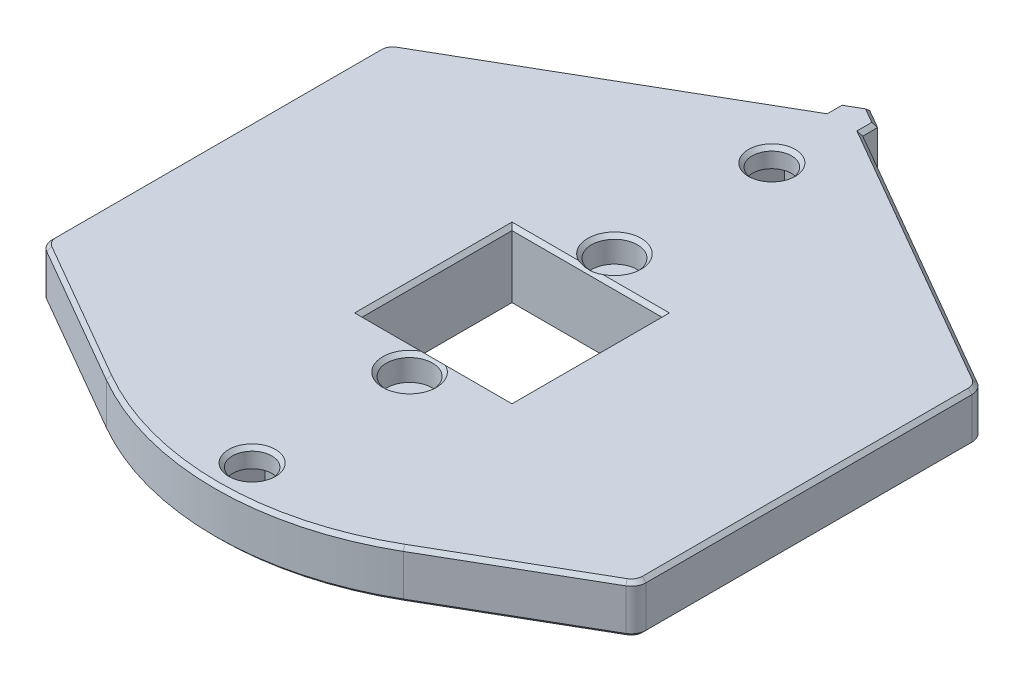
from build123d import *

# Parameters (mm, degrees)
SKETCH1_W           = 20.2
SKETCH1_H           = 20.2
BOSS_EXTRUDE1_DEPTH = 3.55
SKETCH5_R           = 17.475
SKETCH5_W           = 20.2
SKETCH5_H           = 20.2
BOSS_EXTRUDE2_DEPTH = 5.85
SKETCH6_R           = 21
SKETCH6_R_2         = 17.475
BOSS_EXTRUDE3_DEPTH = 0.75
SKETCH7_R           = 1.8
CUT_EXTRUDE4_DEPTH  = 62.819845789
SKETCH7_3_R         = 3.1
SKETCH7_3_R_2       = 1.8
CUT_EXTRUDE5_DEPTH  = 3.4
SKETCH8_R           = 1.8
BOSS_EXTRUDE4_DEPTH = 0.2
BOSS_EXTRUDE5_START = 3
SKETCH11_R          = 30.75
BOSS_EXTRUDE5_DEPTH = 3
SKETCH9_R           = 2.65
CUT_EXTRUDE6_DEPTH  = 62.819845789
CUT_EXTRUDE7_DEPTH  = 4
BOSS_EXTRUDE7_DEPTH = 6.55
FILLET2_R           = 2
CHAMFER2_SIZE       = 0.5


with BuildPart() as part:
    # Sketch1 → Boss-Extrude1 (new body)
    with BuildSketch(Plane(origin=(0, 0, 0), x_dir=(1, 0, 0), z_dir=(0, 1, 0))):
        with BuildLine():
            Line((0, 46.188021535), (-40, 23.094010768))
            Line((-40, 23.094010768), (-40, -23.094010768))
            Line((-40, -23.094010768), (-20, -34.641016151))
            ThreePointArc((-20, -34.641016151), (0, -40), (20, -34.641016151))
            Line((20, -34.641016151), (40, -23.094010768))
            Line((40, -23.094010768), (40, 23.094010768))
            Line((40, 23.094010768), (0, 46.188021535))
        make_face()
        Rectangle(SKETCH1_W, SKETCH1_H, mode=Mode.SUBTRACT)
    extrude(amount=BOSS_EXTRUDE1_DEPTH)

    # Sketch5 → Boss-Extrude2 (add)
    with BuildSketch(Plane.XZ):
        with Locations(Location((0, 0, 0), (0, 0, 90))):
            Circle(SKETCH5_R)
        Rectangle(SKETCH5_W, SKETCH5_H, mode=Mode.SUBTRACT)
    extrude(amount=BOSS_EXTRUDE2_DEPTH)

    # Sketch6 → Boss-Extrude3 (add)
    with BuildSketch(Plane.XZ):
        with Locations(Location((0, 0, 0), (0, 0, 90))):
            Circle(SKETCH6_R)
        with Locations(Location((0, 0, 0), (0, 0, 270))):
            Circle(SKETCH6_R_2, mode=Mode.SUBTRACT)
    extrude(amount=BOSS_EXTRUDE3_DEPTH)

    # Sketch7 → Cut-Extrude4 (cut, through all)
    with BuildSketch(Plane(origin=(0, 3.55, 0), x_dir=(1, 0, 0), z_dir=(0, 1, 0))):
        with Locations(Location((0, 13.8, 0), (0, 0, 270))):
            Circle(SKETCH7_R)
        with Locations(Location((0, -13.8, 0), (0, 0, 270))):
            Circle(SKETCH7_R)
    extrude(amount=-CUT_EXTRUDE4_DEPTH, mode=Mode.SUBTRACT)

    # Sketch7<3> → Cut-Extrude5 (cut)
    # profile 1 of 2: a face of its own
    with BuildSketch(Plane(origin=(0, 3.55, 0), x_dir=(1, 0, 0), z_dir=(0, 1, 0))):
        with Locations(Location((0, 13.8, 0), (0, 0, 270))):
            Circle(SKETCH7_3_R)
        with Locations(Location((0, 13.8, 0), (0, 0, 270))):
            Circle(SKETCH7_3_R_2, mode=Mode.SUBTRACT)
    # profile 2 of 2: a face of its own
    with BuildSketch(Plane(origin=(0, 3.55, 0), x_dir=(1, 0, 0), z_dir=(0, 1, 0))):
        with Locations(Location((0, -13.8, 0), (0, 0, 90))):
            Circle(SKETCH7_3_R)
        with Locations(Location((0, -13.8, 0), (0, 0, 270))):
            Circle(SKETCH7_3_R_2, mode=Mode.SUBTRACT)
    extrude(amount=-CUT_EXTRUDE5_DEPTH, mode=Mode.SUBTRACT)

    # Sketch8 → Boss-Extrude4 (add)
    with BuildSketch(Plane(origin=(0, 0.15, 0), x_dir=(1, 0, 0), z_dir=(0, 1, 0))):
        with Locations(Location((0, 13.8, 0), (0, 0, 270))):
            Circle(SKETCH8_R)
        with Locations(Location((0, -13.8, 0), (0, 0, 270))):
            Circle(SKETCH8_R)
    extrude(amount=-BOSS_EXTRUDE4_DEPTH)

    # Sketch11 → Boss-Extrude5 (add)
    with BuildSketch(Plane.XZ.offset(BOSS_EXTRUDE5_START)):
        with BuildLine():
            Line((-40, 23.094010768), (-40, -23.094010768))
            Line((-40, -23.094010768), (0, -46.188021535))
            Line((0, -46.188021535), (40, -23.094010768))
            Line((40, -23.094010768), (40, 23.094010768))
            Line((40, 23.094010768), (20, 34.641016151))
            ThreePointArc((20, 34.641016151), (0, 40), (-20, 34.641016151))
            Line((-20, 34.641016151), (-40, 23.094010768))
        make_face()
        with Locations(Location((0, 0, 0), (0, 0, 270))):
            Circle(SKETCH11_R, mode=Mode.SUBTRACT)
    extrude(amount=-BOSS_EXTRUDE5_DEPTH)

    # Sketch9 → Cut-Extrude6 (cut, through all)
    with BuildSketch(Plane(origin=(0, 3.55, 0), x_dir=(1, 0, 0), z_dir=(0, 1, 0))):
        with Locations(Location((0, 35, 0), (0, 0, 270))):
            Circle(SKETCH9_R)
        with Locations(Location((0, -35, 0), (0, 0, 270))):
            Circle(SKETCH9_R)
    extrude(amount=-CUT_EXTRUDE6_DEPTH, mode=Mode.SUBTRACT)

    # Sketch10 → Cut-Extrude7 (cut)
    with BuildSketch(Plane.XZ.offset(3)):
        Polygon((2.367136104, 39.1), (-2.367136104, 39.1), (-4.734272207, 35), (-2.367136104, 30.9), (2.367136104, 30.9), (4.734272207, 35), align=None)
        Polygon((4.734272207, -35), (2.367136104, -39.1), (-2.367136104, -39.1), (-4.734272207, -35), (-2.367136104, -30.9), (2.367136104, -30.9), align=None)
    extrude(amount=-CUT_EXTRUDE7_DEPTH, mode=Mode.SUBTRACT)

    # Sketch15 → Boss-Extrude7 (add)
    with BuildSketch(Plane(origin=(0, 3.55, 0), x_dir=(1, 0, 0), z_dir=(0, 1, 0))):
        Polygon((2.5, 44.744645862), (2.5, 46.744645862), (0, 48.188021535), (-2.5, 46.744645862), (-2.5, 44.744645862), align=None)
    extrude(amount=-BOSS_EXTRUDE7_DEPTH)

    # Fillet2
    fillet2_edges = [part.edges().sort_by_distance(p)[0] for p in [
        (-40, 0.275, 23.094010768),
        (-40, 0.275, -23.094010768),
        (40, 0.275, -23.094010768),
        (40, 0.275, 23.094010768),
    ]]
    fillet(fillet2_edges, radius=FILLET2_R)

    # Chamfer2
    # the kernel refuses this chamfer: 0.5 mm, written as the material it takes off along each edge
    with BuildSketch(Plane(origin=(0, -5.85, -13.8), x_dir=(0, 0, 1), z_dir=(-1, 0, 0))) as chamfer2_piece_1:
        Polygon((1.8 + CHAMFER2_SIZE, 0), (1.8, CHAMFER2_SIZE), (1.8, 0), align=None)
    revolve(axis=Axis((0, -5.85, -13.8), (0, 1, 0)), mode=Mode.SUBTRACT)
    with BuildSketch(Plane(origin=(-10.1, -5.85, -10.1), x_dir=(0.027495876610585647, 0.9996219169112968, 0), z_dir=(0, 0, 1)), Plane(origin=(10.1, -5.85, -10.1), x_dir=(0, 0.9996219169112968, 0.027495876610585647), z_dir=(-1, 0, 0)), Plane(origin=(10.1, -5.85, 10.1), x_dir=(-0.0274958766105822, 0.999621916911297, 0), z_dir=(0, 0, -1)), Plane(origin=(-10.1, -5.85, 10.1), x_dir=(0, 0.9996219169112968, -0.027495876610585647), z_dir=(1, 0, 0)), Plane(origin=(-10.1, 3.55, -10.1), x_dir=(-0.9996219169112968, 0.02749587661058651, 0), z_dir=(0, 0, 1)), Plane(origin=(-10.1, 3.55, 10.1), x_dir=(0, 0.02749587661058651, 0.9996219169112968), z_dir=(1, 0, 0)), Plane(origin=(10.1, 3.55, 10.1), x_dir=(0.9996219169112968, 0.02749587661058651, 0), z_dir=(0, 0, -1)), Plane(origin=(10.1, 3.55, -10.1), x_dir=(0, 0.02749587661058651, -0.9996219169112968), z_dir=(-1, 0, 0))) as chamfer2_piece_2:
        Polygon((CHAMFER2_SIZE * 0.999621916911, CHAMFER2_SIZE * 0.0274958766106), (-CHAMFER2_SIZE * 0.0274958766106, CHAMFER2_SIZE * 0.999621916911), (0, 0), align=None)
    extrude(amount=20.2, mode=Mode.SUBTRACT)
    with BuildSketch(Plane(origin=(0, -5.85, 0), x_dir=(0, 0, 1), z_dir=(1, 0, 0))) as chamfer2_piece_3:
        Polygon((17.475 - CHAMFER2_SIZE, 0), (17.475, -CHAMFER2_SIZE), (17.475, 0), align=None)
    revolve(axis=Axis((0, -5.85, 0), (0, -1, 0)), mode=Mode.SUBTRACT)
    with BuildSketch(Plane(origin=(0, -5.85, 13.8), x_dir=(0, 0, 1), z_dir=(-1, 0, 0))) as chamfer2_piece_4:
        Polygon((1.8 + CHAMFER2_SIZE, 0), (1.8, CHAMFER2_SIZE), (1.8, 0), align=None)
    revolve(axis=Axis((0, -5.85, 13.8), (0, 1, 0)), mode=Mode.SUBTRACT)
    with BuildSketch(Plane(origin=(38, 3.55, -21.939310229), x_dir=(1, 0, 0), z_dir=(0, 0, 1))) as chamfer2_piece_5:
        Polygon((2, -CHAMFER2_SIZE), (2 - CHAMFER2_SIZE, 0), (2, 0), align=None)
    revolve(axis=Axis((38, 3.55, -21.939310229), (0, 1, 0)), revolution_arc=60, mode=Mode.SUBTRACT)
    with BuildSketch(Plane(origin=(38, -3, -21.939310229), x_dir=(1, 0, 0), z_dir=(0, 0, 1))) as chamfer2_piece_6:
        Polygon((2 - CHAMFER2_SIZE, 0), (2, CHAMFER2_SIZE), (2, 0), align=None)
    revolve(axis=Axis((38, -3, -21.939310229), (0, 1, 0)), revolution_arc=60, mode=Mode.SUBTRACT)
    with BuildSketch(Plane(origin=(40, -3, -21.939310229), x_dir=(-0.9996219169112968, -0.027495876610586605, 0), z_dir=(0, 0, 1)), Plane(origin=(-40, -3, 21.939310229), x_dir=(0.9996219169112968, -0.027495876610586605, 0), z_dir=(0, 0, -1))) as chamfer2_piece_7:
        Polygon((CHAMFER2_SIZE * 0.999621916911, -CHAMFER2_SIZE * 0.0274958766106), (-CHAMFER2_SIZE * 0.0274958766106, -CHAMFER2_SIZE * 0.999621916911), (0, 0), align=None)
    extrude(amount=43.878620458, mode=Mode.SUBTRACT)
    with BuildSketch(Plane(origin=(40, 3.55, 21.939310229), x_dir=(0.02749587661058217, -0.9996219169112968, 0), z_dir=(0, 0, -1)), Plane(origin=(-40, 3.55, -21.939310229), x_dir=(-0.02749587661058217, -0.9996219169112968, 0), z_dir=(0, 0, 1))) as chamfer2_piece_8:
        Polygon((CHAMFER2_SIZE * 0.999621916911, CHAMFER2_SIZE * 0.0274958766106), (-CHAMFER2_SIZE * 0.0274958766106, CHAMFER2_SIZE * 0.999621916911), (0, 0), align=None)
    extrude(amount=43.878620458, mode=Mode.SUBTRACT)
    with BuildSketch(Plane(origin=(38, 3.55, 21.939310229), x_dir=(0.5000000000000006, 0, 0.8660254037844384), z_dir=(-0.8660254037844384, 0, 0.5000000000000006))) as chamfer2_piece_9:
        Polygon((2, -CHAMFER2_SIZE), (2 - CHAMFER2_SIZE, 0), (2, 0), align=None)
    revolve(axis=Axis((38, 3.55, 21.939310229), (0, 1, 0)), revolution_arc=60, mode=Mode.SUBTRACT)
    with BuildSketch(Plane(origin=(38, -3, 21.939310229), x_dir=(0.4999999999999998, 0, 0.8660254037844389), z_dir=(-0.8660254037844389, 0, 0.4999999999999998))) as chamfer2_piece_10:
        Polygon((2 - CHAMFER2_SIZE, 0), (2, CHAMFER2_SIZE), (2, 0), align=None)
    revolve(axis=Axis((38, -3, 21.939310229), (0, 1, 0)), revolution_arc=60, mode=Mode.SUBTRACT)
    with BuildSketch(Plane(origin=(39, -3, 23.671361037), x_dir=(-0.49981095845564816, -0.027495876610586535, -0.8656979742248805), z_dir=(-0.8660254037844388, 0, 0.49999999999999983)), Plane(origin=(-20, -3, 34.641016151), x_dir=(0.49981095845564866, -0.027495876610586698, -0.8656979742248802), z_dir=(-0.8660254037844385, 0, -0.5000000000000003))) as chamfer2_piece_11:
        Polygon((CHAMFER2_SIZE * 0.999621916911, -CHAMFER2_SIZE * 0.0274958766106), (-CHAMFER2_SIZE * 0.0274958766106, -CHAMFER2_SIZE * 0.999621916911), (0, 0), align=None)
    extrude(amount=21.939310229, mode=Mode.SUBTRACT)
    with BuildSketch(Plane(origin=(20, 3.55, 34.641016151), x_dir=(0.01374793830529137, -0.9996219169112968, 0.023812127644087033), z_dir=(0.8660254037844388, 0, -0.49999999999999983)), Plane(origin=(-39, 3.55, 23.671361037), x_dir=(-0.013747938305290924, -0.999621916911297, 0.023812127644086228), z_dir=(0.8660254037844385, 0, 0.5000000000000003))) as chamfer2_piece_12:
        Polygon((CHAMFER2_SIZE * 0.999621916911, CHAMFER2_SIZE * 0.0274958766106), (-CHAMFER2_SIZE * 0.0274958766106, CHAMFER2_SIZE * 0.999621916911), (0, 0), align=None)
    extrude(amount=21.939310229, mode=Mode.SUBTRACT)
    with BuildSketch(Plane(origin=(0, -3, 0), x_dir=(0.4999999999999993, 0, 0.8660254037844392), z_dir=(0.8660254037844392, 0, -0.4999999999999993))) as chamfer2_piece_13:
        Polygon((40 - CHAMFER2_SIZE, 0), (40, -CHAMFER2_SIZE), (40, 0), align=None)
    revolve(axis=Axis((0, -3, 0), (0, -1, 0)), revolution_arc=60, mode=Mode.SUBTRACT)
    with BuildSketch(Plane(origin=(0, 3.55, 0), x_dir=(-0.4999999999999993, 0, 0.8660254037844392), z_dir=(-0.8660254037844392, 0, -0.4999999999999993))) as chamfer2_piece_14:
        Polygon((40, -CHAMFER2_SIZE), (40 - CHAMFER2_SIZE, 0), (40, 0), align=None)
    revolve(axis=Axis((0, 3.55, 0), (0, 1, 0)), revolution_arc=60, mode=Mode.SUBTRACT)
    with BuildSketch(Plane(origin=(-38, 3.55, 21.939310229), x_dir=(-1, 0, 0), z_dir=(0, 0, -1))) as chamfer2_piece_15:
        Polygon((2, -CHAMFER2_SIZE), (2 - CHAMFER2_SIZE, 0), (2, 0), align=None)
    revolve(axis=Axis((-38, 3.55, 21.939310229), (0, 1, 0)), revolution_arc=60, mode=Mode.SUBTRACT)
    with BuildSketch(Plane(origin=(-38, -3, 21.939310229), x_dir=(-1, 0, 0), z_dir=(0, 0, -1))) as chamfer2_piece_16:
        Polygon((2 - CHAMFER2_SIZE, 0), (2, CHAMFER2_SIZE), (2, 0), align=None)
    revolve(axis=Axis((-38, -3, 21.939310229), (0, 1, 0)), revolution_arc=60, mode=Mode.SUBTRACT)
    with BuildSketch(Plane(origin=(-38, 3.55, -21.939310229), x_dir=(-0.4999999999999998, 0, -0.8660254037844389), z_dir=(0.8660254037844389, 0, -0.4999999999999998))) as chamfer2_piece_17:
        Polygon((2, -CHAMFER2_SIZE), (2 - CHAMFER2_SIZE, 0), (2, 0), align=None)
    revolve(axis=Axis((-38, 3.55, -21.939310229), (0, 1, 0)), revolution_arc=60, mode=Mode.SUBTRACT)
    with BuildSketch(Plane(origin=(-38, -3, -21.939310229), x_dir=(-0.4999999999999998, 0, -0.8660254037844389), z_dir=(0.8660254037844389, 0, -0.4999999999999998))) as chamfer2_piece_18:
        Polygon((2 - CHAMFER2_SIZE, 0), (2, CHAMFER2_SIZE), (2, 0), align=None)
    revolve(axis=Axis((-38, -3, -21.939310229), (0, 1, 0)), revolution_arc=60, mode=Mode.SUBTRACT)
    with BuildSketch(Plane(origin=(-39, -3, -23.671361037), x_dir=(0.49981095845564816, -0.027495876610586535, 0.8656979742248805), z_dir=(0.8660254037844388, 0, -0.49999999999999983))) as chamfer2_piece_19_section:
        Polygon((CHAMFER2_SIZE * 0.999621916911, -CHAMFER2_SIZE * 0.0274958766106), (-CHAMFER2_SIZE * 0.0274958766106, -CHAMFER2_SIZE * 0.999621916911), (0, 0), align=None)
    chamfer2_piece_19 = extrude(amount=43.432411145, mode=Mode.PRIVATE)
    chamfer2_piece_19 = split(chamfer2_piece_19, bisect_by=Plane(origin=(-2.5, -2.834986661, -34.041618041), z_dir=(-1, 0, 0)), keep=Keep.TOP, mode=Mode.PRIVATE)
    add(chamfer2_piece_19, mode=Mode.SUBTRACT)
    with BuildSketch(Plane(origin=(-1.386428601, 3.55, -45.387566609), x_dir=(-0.013747938305292556, -0.9996219169112968, -0.02381212764408909), z_dir=(-0.8660254037844388, 0, 0.49999999999999983))) as chamfer2_piece_20_section:
        Polygon((CHAMFER2_SIZE * 0.999621916911, CHAMFER2_SIZE * 0.0274958766106), (-CHAMFER2_SIZE * 0.0274958766106, CHAMFER2_SIZE * 0.999621916911), (0, 0), align=None)
    chamfer2_piece_20 = extrude(amount=43.432411145, mode=Mode.PRIVATE)
    chamfer2_piece_20 = split(chamfer2_piece_20, bisect_by=Plane(origin=(-2.5, 3.384986661, -34.041618041), z_dir=(-1, 0, 0)), keep=Keep.TOP, mode=Mode.PRIVATE)
    add(chamfer2_piece_20, mode=Mode.SUBTRACT)
    with BuildSketch(Plane(origin=(39, 3.55, -23.671361037), x_dir=(0.013747938305291378, -0.9996219169112968, -0.02381212764408703), z_dir=(-0.8660254037844387, 0, -0.5000000000000001))) as chamfer2_piece_21_section:
        Polygon((CHAMFER2_SIZE * 0.999621916911, CHAMFER2_SIZE * 0.0274958766106), (-CHAMFER2_SIZE * 0.0274958766106, CHAMFER2_SIZE * 0.999621916911), (0, 0), align=None)
    chamfer2_piece_21 = extrude(amount=43.432411145, mode=Mode.PRIVATE)
    chamfer2_piece_21 = split(chamfer2_piece_21, bisect_by=Plane(origin=(2.5, 3.384986661, -34.041618041), z_dir=(1, 0, 0)), keep=Keep.TOP, mode=Mode.PRIVATE)
    add(chamfer2_piece_21, mode=Mode.SUBTRACT)
    with BuildSketch(Plane(origin=(1.386428601, -3, -45.387566609), x_dir=(-0.4998109584556485, -0.027495876610586677, 0.8656979742248804), z_dir=(0.8660254037844387, 0, 0.5000000000000001))) as chamfer2_piece_22_section:
        Polygon((CHAMFER2_SIZE * 0.999621916911, -CHAMFER2_SIZE * 0.0274958766106), (-CHAMFER2_SIZE * 0.0274958766106, -CHAMFER2_SIZE * 0.999621916911), (0, 0), align=None)
    chamfer2_piece_22 = extrude(amount=43.432411145, mode=Mode.PRIVATE)
    chamfer2_piece_22 = split(chamfer2_piece_22, bisect_by=Plane(origin=(2.5, -2.834986661, -34.041618041), z_dir=(1, 0, 0)), keep=Keep.TOP, mode=Mode.PRIVATE)
    add(chamfer2_piece_22, mode=Mode.SUBTRACT)
    with BuildSketch(Plane(origin=(0, 3.55, 13.8), x_dir=(0, 0, -1), z_dir=(1, 0, 0))) as chamfer2_piece_23:
        Polygon((3.1 + CHAMFER2_SIZE, 0), (3.1, -CHAMFER2_SIZE), (3.1, 0), align=None)
    revolve(axis=Axis((0, 3.55, 13.8), (0, 1, 0)), mode=Mode.SUBTRACT)
    with BuildSketch(Plane(origin=(0, 3.55, -13.8), x_dir=(0, 0, 1), z_dir=(-1, 0, 0))) as chamfer2_piece_24:
        Polygon((3.1 + CHAMFER2_SIZE, 0), (3.1, -CHAMFER2_SIZE), (3.1, 0), align=None)
    revolve(axis=Axis((0, 3.55, -13.8), (0, 1, 0)), mode=Mode.SUBTRACT)
    with BuildSketch(Plane(origin=(0, 3.55, 35), x_dir=(0, 0, 1), z_dir=(-1, 0, 0))) as chamfer2_piece_25:
        Polygon((2.65 + CHAMFER2_SIZE, 0), (2.65, -CHAMFER2_SIZE), (2.65, 0), align=None)
    revolve(axis=Axis((0, 3.55, 35), (0, 1, 0)), mode=Mode.SUBTRACT)
    with BuildSketch(Plane(origin=(0, 3.55, -35), x_dir=(0, 0, 1), z_dir=(-1, 0, 0))) as chamfer2_piece_26:
        Polygon((2.65 + CHAMFER2_SIZE, 0), (2.65, -CHAMFER2_SIZE), (2.65, 0), align=None)
    revolve(axis=Axis((0, 3.55, -35), (0, 1, 0)), mode=Mode.SUBTRACT)
    with BuildSketch(Plane(origin=(0, -3, 0), x_dir=(0, 0, -1), z_dir=(-1, 0, 0))) as chamfer2_piece_27:
        Polygon((30.75 + CHAMFER2_SIZE, 0), (30.75, -CHAMFER2_SIZE), (30.75, 0), align=None)
    revolve(axis=Axis((0, -3, 0), (0, -1, 0)), mode=Mode.SUBTRACT)
    with BuildSketch(Plane(origin=(-2.5, 3.55, -48.030487356), x_dir=(-0.027495876610586487, -0.9996219169112968, 0), z_dir=(0, 0, 1))) as chamfer2_piece_28_section:
        Polygon((CHAMFER2_SIZE * 0.999621916911, CHAMFER2_SIZE * 0.0274958766106), (-CHAMFER2_SIZE * 0.0274958766106, CHAMFER2_SIZE * 0.999621916911), (0, 0), align=None)
    chamfer2_piece_28 = extrude(amount=4.571682988, mode=Mode.PRIVATE)
    chamfer2_piece_28 = split(chamfer2_piece_28, bisect_by=Plane(origin=(-1.646823364, 3.383567419, -45.237227622), z_dir=(-0.49999999999999983, 0, -0.8660254037844388)), keep=Keep.TOP, mode=Mode.PRIVATE)
    add(chamfer2_piece_28, mode=Mode.SUBTRACT)
    with BuildSketch(Plane(origin=(1.113571399, 3.55, -48.830942282), x_dir=(-0.013747938305292551, -0.9996219169112968, -0.023812127644088844), z_dir=(-0.8660254037844367, 0, 0.5000000000000036)), Plane(origin=(3.613571399, 3.55, -46.101725115), x_dir=(0.013747938305292551, -0.9996219169112968, -0.023812127644088844), z_dir=(-0.8660254037844367, 0, -0.5000000000000036))) as chamfer2_piece_29:
        Polygon((CHAMFER2_SIZE * 0.999621916911, CHAMFER2_SIZE * 0.0274958766106), (-CHAMFER2_SIZE * 0.0274958766106, CHAMFER2_SIZE * 0.999621916911), (0, 0), align=None)
    extrude(amount=5.458434334, mode=Mode.SUBTRACT)
    with BuildSketch(Plane(origin=(2.5, 3.55, -43.458804368), x_dir=(0.027495876610586487, -0.9996219169112968, 0), z_dir=(0, 0, -1))) as chamfer2_piece_30_section:
        Polygon((CHAMFER2_SIZE * 0.999621916911, CHAMFER2_SIZE * 0.0274958766106), (-CHAMFER2_SIZE * 0.0274958766106, CHAMFER2_SIZE * 0.999621916911), (0, 0), align=None)
    chamfer2_piece_30 = extrude(amount=4.571682988, mode=Mode.PRIVATE)
    chamfer2_piece_30 = split(chamfer2_piece_30, bisect_by=Plane(origin=(1.646823364, 3.383567419, -45.237227622), z_dir=(0.5000000000000001, 0, -0.8660254037844387)), keep=Keep.TOP, mode=Mode.PRIVATE)
    add(chamfer2_piece_30, mode=Mode.SUBTRACT)
    with BuildSketch(Plane(origin=(-10.1, -5.85, -11.385841494), x_dir=(0.027495876610585647, 0.9996219169112968, 0), z_dir=(0, 0, 1))) as chamfer2_piece_31a_section:
        Polygon((CHAMFER2_SIZE * 0.999621916911, CHAMFER2_SIZE * 0.0274958766106), (-CHAMFER2_SIZE * 0.0274958766106, CHAMFER2_SIZE * 0.999621916911), (0, 0), align=None)
    chamfer2_piece_31a = extrude(amount=21.485841494, mode=Mode.PRIVATE)
    chamfer2_piece_31a = split(chamfer2_piece_31a, bisect_by=Plane(origin=(-10.264896813, -5.685103187, -10.1), z_dir=(0, 0, -1)), keep=Keep.TOP, mode=Mode.PRIVATE)
    with BuildSketch(Plane(origin=(10.1, -5.85, -10.1), x_dir=(0, 0.9996219169112968, 0.027495876610585647), z_dir=(-1, 0, 0))) as chamfer2_piece_31b_section:
        Polygon((CHAMFER2_SIZE * 0.999621916911, CHAMFER2_SIZE * 0.0274958766106), (-CHAMFER2_SIZE * 0.0274958766106, CHAMFER2_SIZE * 0.999621916911), (0, 0), align=None)
    chamfer2_piece_31b = extrude(amount=21.485841494, mode=Mode.PRIVATE)
    chamfer2_piece_31b = split(chamfer2_piece_31b, bisect_by=Plane(origin=(-10.1, -5.685103187, -10.264896813), z_dir=(-1, 0, 0)), keep=Keep.TOP, mode=Mode.PRIVATE)
    chamfer2_piece_31 = chamfer2_piece_31a & chamfer2_piece_31b
    add(chamfer2_piece_31, mode=Mode.SUBTRACT)
    with BuildSketch(Plane(origin=(-10.1, -5.85, -10.1), x_dir=(0.027495876610585647, 0.9996219169112968, 0), z_dir=(0, 0, 1))) as chamfer2_piece_32a_section:
        Polygon((CHAMFER2_SIZE * 0.999621916911, CHAMFER2_SIZE * 0.0274958766106), (-CHAMFER2_SIZE * 0.0274958766106, CHAMFER2_SIZE * 0.999621916911), (0, 0), align=None)
    chamfer2_piece_32a = extrude(amount=21.485841494, mode=Mode.PRIVATE)
    chamfer2_piece_32a = split(chamfer2_piece_32a, bisect_by=Plane(origin=(-10.264896813, -5.685103187, 10.1), z_dir=(0, 0, 1)), keep=Keep.TOP, mode=Mode.PRIVATE)
    with BuildSketch(Plane(origin=(-11.385841494, -5.85, 10.1), x_dir=(0, 0.9996219169112968, -0.027495876610585647), z_dir=(1, 0, 0))) as chamfer2_piece_32b_section:
        Polygon((CHAMFER2_SIZE * 0.999621916911, CHAMFER2_SIZE * 0.0274958766106), (-CHAMFER2_SIZE * 0.0274958766106, CHAMFER2_SIZE * 0.999621916911), (0, 0), align=None)
    chamfer2_piece_32b = extrude(amount=21.485841494, mode=Mode.PRIVATE)
    chamfer2_piece_32b = split(chamfer2_piece_32b, bisect_by=Plane(origin=(-10.1, -5.685103187, 10.264896813), z_dir=(-1, 0, 0)), keep=Keep.TOP, mode=Mode.PRIVATE)
    chamfer2_piece_32 = chamfer2_piece_32a & chamfer2_piece_32b
    add(chamfer2_piece_32, mode=Mode.SUBTRACT)
    with BuildSketch(Plane(origin=(11.385841494, -5.85, -10.1), x_dir=(0, 0.9996219169112968, 0.027495876610585647), z_dir=(-1, 0, 0))) as chamfer2_piece_33a_section:
        Polygon((CHAMFER2_SIZE * 0.999621916911, CHAMFER2_SIZE * 0.0274958766106), (-CHAMFER2_SIZE * 0.0274958766106, CHAMFER2_SIZE * 0.999621916911), (0, 0), align=None)
    chamfer2_piece_33a = extrude(amount=21.485841494, mode=Mode.PRIVATE)
    chamfer2_piece_33a = split(chamfer2_piece_33a, bisect_by=Plane(origin=(10.1, -5.685103187, -10.264896813), z_dir=(1, 0, 0)), keep=Keep.TOP, mode=Mode.PRIVATE)
    with BuildSketch(Plane(origin=(10.1, -5.85, 10.1), x_dir=(-0.0274958766105822, 0.999621916911297, 0), z_dir=(0, 0, -1))) as chamfer2_piece_33b_section:
        Polygon((CHAMFER2_SIZE * 0.999621916911, CHAMFER2_SIZE * 0.0274958766106), (-CHAMFER2_SIZE * 0.0274958766106, CHAMFER2_SIZE * 0.999621916911), (0, 0), align=None)
    chamfer2_piece_33b = extrude(amount=21.485841494, mode=Mode.PRIVATE)
    chamfer2_piece_33b = split(chamfer2_piece_33b, bisect_by=Plane(origin=(10.264896813, -5.685103187, -10.1), z_dir=(0, 0, -1)), keep=Keep.TOP, mode=Mode.PRIVATE)
    chamfer2_piece_33 = chamfer2_piece_33a & chamfer2_piece_33b
    add(chamfer2_piece_33, mode=Mode.SUBTRACT)
    with BuildSketch(Plane(origin=(10.1, -5.85, 11.385841494), x_dir=(-0.027495876610585647, 0.9996219169112968, 0), z_dir=(0, 0, -1))) as chamfer2_piece_34a_section:
        Polygon((CHAMFER2_SIZE * 0.999621916911, CHAMFER2_SIZE * 0.0274958766106), (-CHAMFER2_SIZE * 0.0274958766106, CHAMFER2_SIZE * 0.999621916911), (0, 0), align=None)
    chamfer2_piece_34a = extrude(amount=21.485841494, mode=Mode.PRIVATE)
    chamfer2_piece_34a = split(chamfer2_piece_34a, bisect_by=Plane(origin=(10.264896813, -5.685103187, 10.1), z_dir=(0, 0, 1)), keep=Keep.TOP, mode=Mode.PRIVATE)
    with BuildSketch(Plane(origin=(-10.1, -5.85, 10.1), x_dir=(0, 0.9996219169112968, -0.027495876610585647), z_dir=(1, 0, 0))) as chamfer2_piece_34b_section:
        Polygon((CHAMFER2_SIZE * 0.999621916911, CHAMFER2_SIZE * 0.0274958766106), (-CHAMFER2_SIZE * 0.0274958766106, CHAMFER2_SIZE * 0.999621916911), (0, 0), align=None)
    chamfer2_piece_34b = extrude(amount=21.485841494, mode=Mode.PRIVATE)
    chamfer2_piece_34b = split(chamfer2_piece_34b, bisect_by=Plane(origin=(10.1, -5.685103187, 10.264896813), z_dir=(1, 0, 0)), keep=Keep.TOP, mode=Mode.PRIVATE)
    chamfer2_piece_34 = chamfer2_piece_34a & chamfer2_piece_34b
    add(chamfer2_piece_34, mode=Mode.SUBTRACT)
    with BuildSketch(Plane(origin=(-10.1, 3.55, -11.385841494), x_dir=(-0.9996219169112968, 0.02749587661058651, 0), z_dir=(0, 0, 1))) as chamfer2_piece_35a_section:
        Polygon((CHAMFER2_SIZE * 0.999621916911, CHAMFER2_SIZE * 0.0274958766106), (-CHAMFER2_SIZE * 0.0274958766106, CHAMFER2_SIZE * 0.999621916911), (0, 0), align=None)
    chamfer2_piece_35a = extrude(amount=21.485841494, mode=Mode.PRIVATE)
    chamfer2_piece_35a = split(chamfer2_piece_35a, bisect_by=Plane(origin=(-10.264896813, 3.385103187, -10.1), z_dir=(0, 0, -1)), keep=Keep.TOP, mode=Mode.PRIVATE)
    with BuildSketch(Plane(origin=(10.1, 3.55, -10.1), x_dir=(0, 0.02749587661058651, -0.9996219169112968), z_dir=(-1, 0, 0))) as chamfer2_piece_35b_section:
        Polygon((CHAMFER2_SIZE * 0.999621916911, CHAMFER2_SIZE * 0.0274958766106), (-CHAMFER2_SIZE * 0.0274958766106, CHAMFER2_SIZE * 0.999621916911), (0, 0), align=None)
    chamfer2_piece_35b = extrude(amount=21.485841494, mode=Mode.PRIVATE)
    chamfer2_piece_35b = split(chamfer2_piece_35b, bisect_by=Plane(origin=(-10.1, 3.385103187, -10.264896813), z_dir=(-1, 0, 0)), keep=Keep.TOP, mode=Mode.PRIVATE)
    chamfer2_piece_35 = chamfer2_piece_35a & chamfer2_piece_35b
    add(chamfer2_piece_35, mode=Mode.SUBTRACT)
    with BuildSketch(Plane(origin=(-10.1, 3.55, -10.1), x_dir=(-0.9996219169112968, 0.02749587661058651, 0), z_dir=(0, 0, 1))) as chamfer2_piece_36a_section:
        Polygon((CHAMFER2_SIZE * 0.999621916911, CHAMFER2_SIZE * 0.0274958766106), (-CHAMFER2_SIZE * 0.0274958766106, CHAMFER2_SIZE * 0.999621916911), (0, 0), align=None)
    chamfer2_piece_36a = extrude(amount=21.485841494, mode=Mode.PRIVATE)
    chamfer2_piece_36a = split(chamfer2_piece_36a, bisect_by=Plane(origin=(-10.264896813, 3.385103187, 10.1), z_dir=(0, 0, 1)), keep=Keep.TOP, mode=Mode.PRIVATE)
    with BuildSketch(Plane(origin=(-11.385841494, 3.55, 10.1), x_dir=(0, 0.02749587661058651, 0.9996219169112968), z_dir=(1, 0, 0))) as chamfer2_piece_36b_section:
        Polygon((CHAMFER2_SIZE * 0.999621916911, CHAMFER2_SIZE * 0.0274958766106), (-CHAMFER2_SIZE * 0.0274958766106, CHAMFER2_SIZE * 0.999621916911), (0, 0), align=None)
    chamfer2_piece_36b = extrude(amount=21.485841494, mode=Mode.PRIVATE)
    chamfer2_piece_36b = split(chamfer2_piece_36b, bisect_by=Plane(origin=(-10.1, 3.385103187, 10.264896813), z_dir=(-1, 0, 0)), keep=Keep.TOP, mode=Mode.PRIVATE)
    chamfer2_piece_36 = chamfer2_piece_36a & chamfer2_piece_36b
    add(chamfer2_piece_36, mode=Mode.SUBTRACT)
    with BuildSketch(Plane(origin=(10.1, 3.55, 11.385841494), x_dir=(0.9996219169112968, 0.02749587661058651, 0), z_dir=(0, 0, -1))) as chamfer2_piece_37a_section:
        Polygon((CHAMFER2_SIZE * 0.999621916911, CHAMFER2_SIZE * 0.0274958766106), (-CHAMFER2_SIZE * 0.0274958766106, CHAMFER2_SIZE * 0.999621916911), (0, 0), align=None)
    chamfer2_piece_37a = extrude(amount=21.485841494, mode=Mode.PRIVATE)
    chamfer2_piece_37a = split(chamfer2_piece_37a, bisect_by=Plane(origin=(10.264896813, 3.385103187, 10.1), z_dir=(0, 0, 1)), keep=Keep.TOP, mode=Mode.PRIVATE)
    with BuildSketch(Plane(origin=(-10.1, 3.55, 10.1), x_dir=(0, 0.02749587661058651, 0.9996219169112968), z_dir=(1, 0, 0))) as chamfer2_piece_37b_section:
        Polygon((CHAMFER2_SIZE * 0.999621916911, CHAMFER2_SIZE * 0.0274958766106), (-CHAMFER2_SIZE * 0.0274958766106, CHAMFER2_SIZE * 0.999621916911), (0, 0), align=None)
    chamfer2_piece_37b = extrude(amount=21.485841494, mode=Mode.PRIVATE)
    chamfer2_piece_37b = split(chamfer2_piece_37b, bisect_by=Plane(origin=(10.1, 3.385103187, 10.264896813), z_dir=(1, 0, 0)), keep=Keep.TOP, mode=Mode.PRIVATE)
    chamfer2_piece_37 = chamfer2_piece_37a & chamfer2_piece_37b
    add(chamfer2_piece_37, mode=Mode.SUBTRACT)
    with BuildSketch(Plane(origin=(11.385841494, 3.55, -10.1), x_dir=(0, 0.02749587661058651, -0.9996219169112968), z_dir=(-1, 0, 0))) as chamfer2_piece_38a_section:
        Polygon((CHAMFER2_SIZE * 0.999621916911, CHAMFER2_SIZE * 0.0274958766106), (-CHAMFER2_SIZE * 0.0274958766106, CHAMFER2_SIZE * 0.999621916911), (0, 0), align=None)
    chamfer2_piece_38a = extrude(amount=21.485841494, mode=Mode.PRIVATE)
    chamfer2_piece_38a = split(chamfer2_piece_38a, bisect_by=Plane(origin=(10.1, 3.385103187, -10.264896813), z_dir=(1, 0, 0)), keep=Keep.TOP, mode=Mode.PRIVATE)
    with BuildSketch(Plane(origin=(10.1, 3.55, 10.1), x_dir=(0.9996219169112968, 0.02749587661058651, 0), z_dir=(0, 0, -1))) as chamfer2_piece_38b_section:
        Polygon((CHAMFER2_SIZE * 0.999621916911, CHAMFER2_SIZE * 0.0274958766106), (-CHAMFER2_SIZE * 0.0274958766106, CHAMFER2_SIZE * 0.999621916911), (0, 0), align=None)
    chamfer2_piece_38b = extrude(amount=21.485841494, mode=Mode.PRIVATE)
    chamfer2_piece_38b = split(chamfer2_piece_38b, bisect_by=Plane(origin=(10.264896813, 3.385103187, -10.1), z_dir=(0, 0, -1)), keep=Keep.TOP, mode=Mode.PRIVATE)
    chamfer2_piece_38 = chamfer2_piece_38a & chamfer2_piece_38b
    add(chamfer2_piece_38, mode=Mode.SUBTRACT)
    with BuildSketch(Plane(origin=(-1.386428601, 3.55, -45.387566609), x_dir=(-0.013747938305292556, -0.9996219169112968, -0.02381212764408909), z_dir=(-0.8660254037844388, 0, 0.49999999999999983))) as chamfer2_piece_39a_section:
        Polygon((CHAMFER2_SIZE * 0.999621916911, CHAMFER2_SIZE * 0.0274958766106), (-CHAMFER2_SIZE * 0.0274958766106, CHAMFER2_SIZE * 0.999621916911), (0, 0), align=None)
    chamfer2_piece_39a = extrude(amount=43.432411145, mode=Mode.PRIVATE)
    chamfer2_piece_39a = split(chamfer2_piece_39a, bisect_by=Plane(origin=(-2.5, 3.388651281, -44.892794962), z_dir=(1, 0, 0)), keep=Keep.TOP, mode=Mode.PRIVATE)
    with BuildSketch(Plane(origin=(-2.5, 3.55, -48.030487356), x_dir=(-0.027495876610586487, -0.9996219169112968, 0), z_dir=(0, 0, 1))) as chamfer2_piece_39b_section:
        Polygon((CHAMFER2_SIZE * 0.999621916911, CHAMFER2_SIZE * 0.0274958766106), (-CHAMFER2_SIZE * 0.0274958766106, CHAMFER2_SIZE * 0.999621916911), (0, 0), align=None)
    chamfer2_piece_39b = extrude(amount=4.571682988, mode=Mode.PRIVATE)
    chamfer2_piece_39b = split(chamfer2_piece_39b, bisect_by=Plane(origin=(-2.628300884, 3.388651281, -44.670571312), z_dir=(0.49999999999999983, 0, 0.8660254037844388)), keep=Keep.TOP, mode=Mode.PRIVATE)
    chamfer2_piece_39 = chamfer2_piece_39a & chamfer2_piece_39b
    add(chamfer2_piece_39, mode=Mode.SUBTRACT)
    with BuildSketch(Plane(origin=(39, 3.55, -23.671361037), x_dir=(0.013747938305291378, -0.9996219169112968, -0.02381212764408703), z_dir=(-0.8660254037844387, 0, -0.5000000000000001))) as chamfer2_piece_40a_section:
        Polygon((CHAMFER2_SIZE * 0.999621916911, CHAMFER2_SIZE * 0.0274958766106), (-CHAMFER2_SIZE * 0.0274958766106, CHAMFER2_SIZE * 0.999621916911), (0, 0), align=None)
    chamfer2_piece_40a = extrude(amount=43.432411145, mode=Mode.PRIVATE)
    chamfer2_piece_40a = split(chamfer2_piece_40a, bisect_by=Plane(origin=(2.5, 3.388651281, -44.892794962), z_dir=(-1, 0, 0)), keep=Keep.TOP, mode=Mode.PRIVATE)
    with BuildSketch(Plane(origin=(2.5, 3.55, -43.458804368), x_dir=(0.027495876610586487, -0.9996219169112968, 0), z_dir=(0, 0, -1))) as chamfer2_piece_40b_section:
        Polygon((CHAMFER2_SIZE * 0.999621916911, CHAMFER2_SIZE * 0.0274958766106), (-CHAMFER2_SIZE * 0.0274958766106, CHAMFER2_SIZE * 0.999621916911), (0, 0), align=None)
    chamfer2_piece_40b = extrude(amount=4.571682988, mode=Mode.PRIVATE)
    chamfer2_piece_40b = split(chamfer2_piece_40b, bisect_by=Plane(origin=(2.628300884, 3.388651281, -44.670571312), z_dir=(-0.5000000000000001, 0, 0.8660254037844387)), keep=Keep.TOP, mode=Mode.PRIVATE)
    chamfer2_piece_40 = chamfer2_piece_40a & chamfer2_piece_40b
    add(chamfer2_piece_40, mode=Mode.SUBTRACT)


solid = part.part
